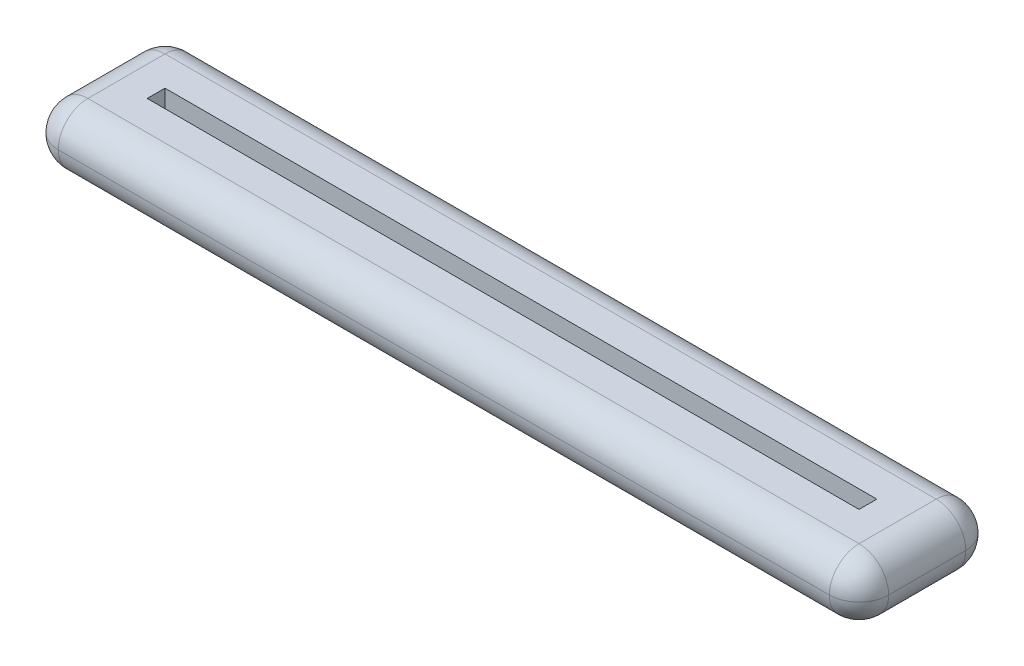
from build123d import *

# Parameters (mm, degrees)
ESQUISSE4_W        = 70
ESQUISSE4_H        = 11.5
ESQUISSE4_W_2      = 60
ESQUISSE4_H_2      = 1.5
BOSS_EXTRU_2_DEPTH = 5
CONG_1_R           = 2.5


with BuildPart() as part:
    # Esquisse4 → Boss.-Extru.2 (new body)
    with BuildSketch(Plane(origin=(0, 0, 0), x_dir=(1, 0, 0), z_dir=(0, 1, 0))):
        Rectangle(ESQUISSE4_W, ESQUISSE4_H)
        Rectangle(ESQUISSE4_W_2, ESQUISSE4_H_2, mode=Mode.SUBTRACT)
    extrude(amount=BOSS_EXTRU_2_DEPTH)

    # Congé1
    cong_1_edges = [part.edges().sort_by_distance(p)[0] for p in [
        (-35, 5, 0),
        (0, 5, 5.75),
        (35, 5, 0),
        (0, 0, 5.75),
        (-35, 0, 0),
        (0, 0, -5.75),
        (35, 0, 0),
        (0, 5, -5.75),
        (35, 2.5, 5.75),
        (-35, 2.5, 5.75),
        (-35, 2.5, -5.75),
        (35, 2.5, -5.75),
    ]]
    fillet(cong_1_edges, radius=CONG_1_R - 0.0001)  # a hair under: the kernel refuses the full size


solid = part.part
